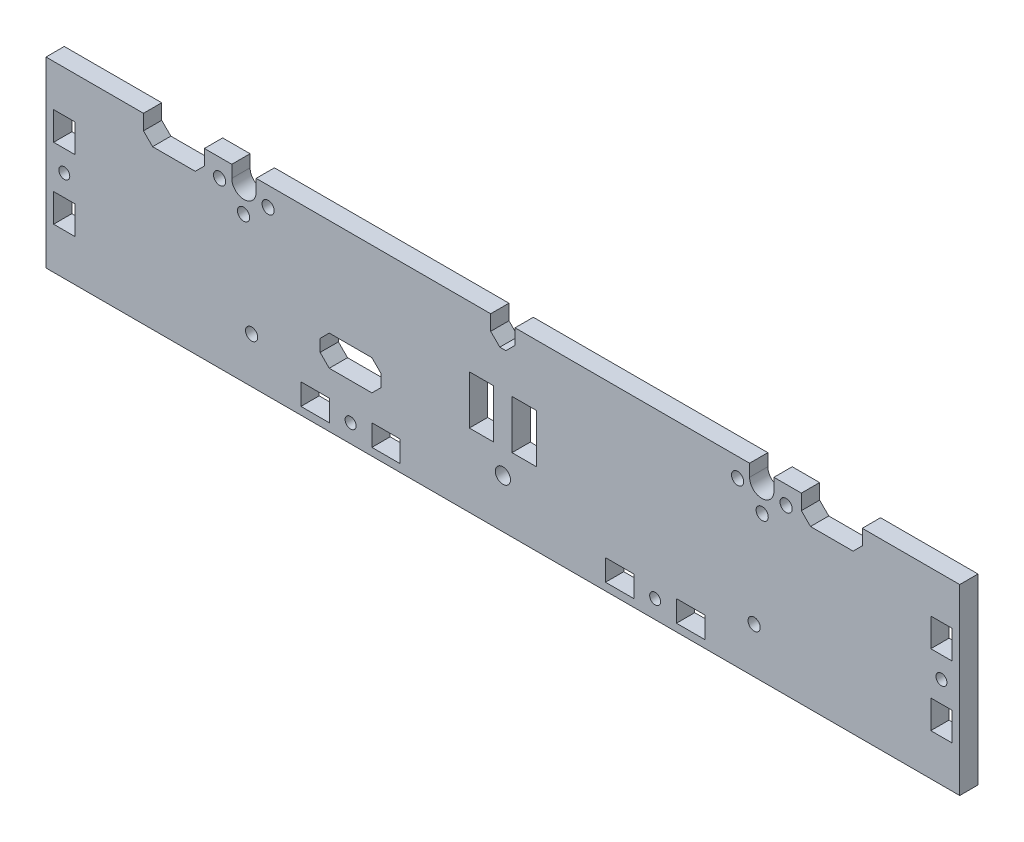
from build123d import *

# Parameters (mm, degrees)
ESQUISSE1_R                      = 2
ESQUISSE1_R_2                    = 1.8
ESQUISSE1_W                      = 7
ESQUISSE1_H                      = 9.3
ESQUISSE1_W_2                    = 9.3
ESQUISSE1_H_2                    = 7
BOSS_EXTRU_1_DEPTH               = 3
R_P_TITION_START                 = -3
R_P_TITION_CIRCULAIRE1_OUTLINE_R = 2
R_P_TITION_CIRCULAIRE1_DEPTH     = 6
CHANFREIN1_SIZE                  = 3
IDLER_REACH                      = 155.922
ESQUISSE2_R                      = 2.5
ESQUISSE2_W                      = 8
ESQUISSE2_H                      = 16
SCREEN_REACH                     = 155.922
ESQUISSE3_R                      = 2


# Read off the part's stored shape, not the designer's step: Répétition circulaire1
with BuildPart() as part:
    # Esquisse1 → Boss.-Extru.1 (new, symmetric)
    with BuildSketch(Plane.XY):
        with BuildLine():
            Line((-150, -26), (0, -26))
            Line((0, -26), (0, 26))
            Line((0, 26), (-4, 26))
            Line((-4, 26), (-4, 34))
            Line((-4, 34), (-81, 34))
            Line((-81, 34), (-81, 30))
            ThreePointArc((-81, 30), (-85, 26), (-89, 30))
            Line((-89, 30), (-89, 34))
            Line((-89, 34), (-98, 34))
            Line((-98, 34), (-98, 26))
            Line((-98, 26), (-118, 26))
            Line((-118, 26), (-118, 34))
            Line((-118, 34), (-150, 34))
            Line((-150, 34), (-150, -26))
        make_face()
        with Locations((-93, 28)):
            Circle(ESQUISSE1_R, mode=Mode.SUBTRACT)
        with Locations((-144, 4)):
            Circle(ESQUISSE1_R_2, mode=Mode.SUBTRACT)
        with Locations((-50, -20)):
            Circle(ESQUISSE1_R_2, mode=Mode.SUBTRACT)
        with Locations((-144, 15.65)):
            Rectangle(ESQUISSE1_W, ESQUISSE1_H, mode=Mode.SUBTRACT)
        with Locations((-144, -7.65)):
            Rectangle(ESQUISSE1_W, ESQUISSE1_H, mode=Mode.SUBTRACT)
        with Locations((-38.35, -20)):
            Rectangle(ESQUISSE1_W_2, ESQUISSE1_H_2, mode=Mode.SUBTRACT)
        with Locations((-61.65, -20)):
            Rectangle(ESQUISSE1_W_2, ESQUISSE1_H_2, mode=Mode.SUBTRACT)
    extrude(amount=BOSS_EXTRU_1_DEPTH, both=True)

    # Répétition circulaire1 outline → Répétition circulaire1 (cut)
    with BuildSketch(Plane.XY.offset(R_P_TITION_START)):
        with Locations((-77.07179677, 27.732050808)):
            Circle(R_P_TITION_CIRCULAIRE1_OUTLINE_R)
        with Locations((-85.138700708, 21.754955299)):
            Circle(R_P_TITION_CIRCULAIRE1_OUTLINE_R)
    extrude(amount=R_P_TITION_CIRCULAIRE1_DEPTH, mode=Mode.SUBTRACT)

    # Chanfrein1
    chanfrein1_edges = [part.edges().sort_by_distance(p)[0] for p in [
        (-118, 26, 0),
        (-98, 26, 0),
        (-4, 26, 0),
    ]]
    chamfer(chanfrein1_edges, length=CHANFREIN1_SIZE)

    # Symétrie2: part across plane


with BuildPart() as part_1:
    add(part.part)
    add(part.part.mirror(Plane(origin=(0, 26, 3), x_dir=(0, 0, 1), z_dir=(-1, 0, 0))))

    # Esquisse2 → idler (cut, up to next)
    with BuildSketch(Plane.XY.offset(3), mode=Mode.PRIVATE) as idler_sk1:
        with Locations((0, -10)):
            Circle(ESQUISSE2_R)
    idler_tool1 = extrude(idler_sk1.sketch, amount=-IDLER_REACH, mode=Mode.PRIVATE) & part_1.part
    # Esquisse2 → idler (cut, up to next)
    with BuildSketch(Plane.XY.offset(3), mode=Mode.PRIVATE) as idler_sk2:
        with Locations((-7, 6)):
            Rectangle(ESQUISSE2_W, ESQUISSE2_H)
    idler_tool2 = extrude(idler_sk2.sketch, amount=-IDLER_REACH, mode=Mode.PRIVATE) & part_1.part
    # Esquisse2 → idler (cut, up to next)
    with BuildSketch(Plane.XY.offset(3), mode=Mode.PRIVATE) as idler_sk3:
        with Locations((7, 6)):
            Rectangle(ESQUISSE2_W, ESQUISSE2_H)
    idler_tool3 = extrude(idler_sk3.sketch, amount=-IDLER_REACH, mode=Mode.PRIVATE) & part_1.part
    add(idler_tool1.solids().sort_by_distance((0, -10, 3))[0], mode=Mode.SUBTRACT)
    add(idler_tool2.solids().sort_by_distance((-7, 6, 3))[0], mode=Mode.SUBTRACT)
    add(idler_tool3.solids().sort_by_distance((7, 6, 3))[0], mode=Mode.SUBTRACT)

    # Esquisse3 → screen (cut, up to next)
    with BuildSketch(Plane.XY.offset(3), mode=Mode.PRIVATE) as screen_sk1:
        with Locations((-82.5, -11)):
            Circle(ESQUISSE3_R)
    screen_tool1 = extrude(screen_sk1.sketch, amount=-SCREEN_REACH, mode=Mode.PRIVATE) & part_1.part
    # Esquisse3 → screen (cut, up to next)
    with BuildSketch(Plane.XY.offset(3), mode=Mode.PRIVATE) as screen_sk2:
        with Locations((82.5, -11)):
            Circle(ESQUISSE3_R)
    screen_tool2 = extrude(screen_sk2.sketch, amount=-SCREEN_REACH, mode=Mode.PRIVATE) & part_1.part
    # Esquisse3 → screen (cut, up to next)
    with BuildSketch(Plane.XY.offset(3), mode=Mode.PRIVATE) as screen_sk3:
        Polygon((-59.999999802, -1), (-56.999999802, 2), (-42.999999802, 2), (-39.999999802, -1), (-39.999999802, -5), (-42.999999802, -8), (-56.999999802, -8), (-59.999999802, -5), align=None)
    screen_tool3 = extrude(screen_sk3.sketch, amount=-SCREEN_REACH, mode=Mode.PRIVATE) & part_1.part
    add(screen_tool1.solids().sort_by_distance((-82.5, -11, 3))[0], mode=Mode.SUBTRACT)
    add(screen_tool2.solids().sort_by_distance((82.5, -11, 3))[0], mode=Mode.SUBTRACT)
    add(screen_tool3.solids().sort_by_distance((-50, -3, 3))[0], mode=Mode.SUBTRACT)


solid = part_1.part
